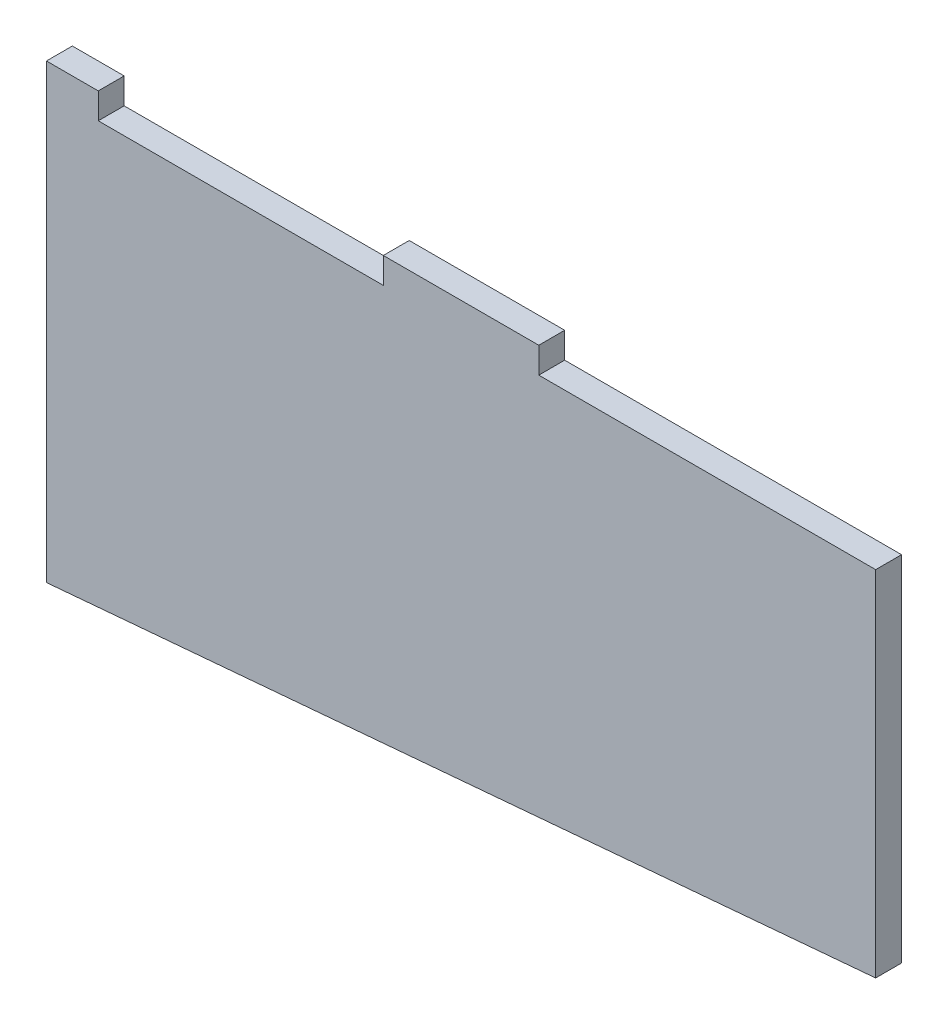
from build123d import *

# Parameters (mm, degrees)
BOSS_EXTRUDE1_DEPTH = 6.35


with BuildPart() as part:
    # Sketch1 → Boss-Extrude1 (new body)
    with BuildSketch(Plane.XY):
        Polygon((0, 0), (12.7, 0), (12.7, -6.35), (82.55, -6.35), (82.55, 0), (120.65, 0), (120.65, -6.35), (203.2, -6.35), (203.2, -93.013916322), (0, -110.694166386), align=None)
    extrude(amount=BOSS_EXTRUDE1_DEPTH)


solid = part.part
